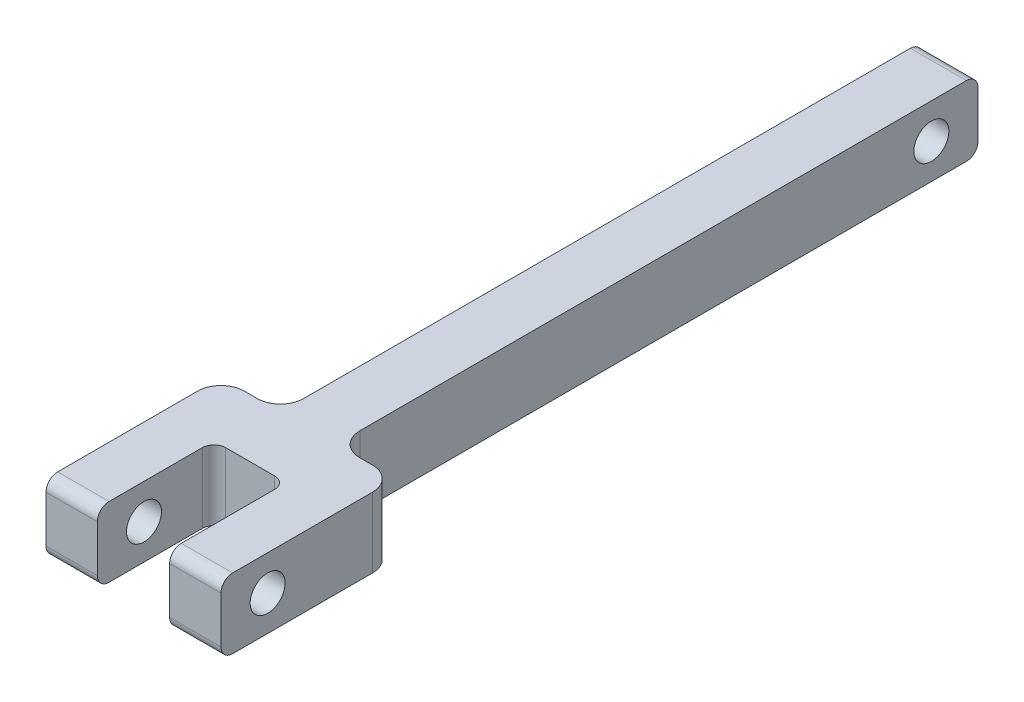
from build123d import *
from build123d.topology import SkipClean

# Parameters (mm, degrees)
SALIENTE_EXTRUIR1_DEPTH    = 2.4
CORTAR_EXTRUIR1_DEPTH      = 36.210225787
CORTAR_EXTRUIR1_DEPTH_BACK = 36.210225787
CROQUIS2_R                 = 1.5
CROQUIS3_R                 = 1.5
SALIENTE_EXTRUIR2_DEPTH    = 7.5
CORTAR_EXTRUIR2_DEPTH      = 3.1
REDONDEO1_R                = 2
REDONDEO2_R                = 1


with BuildPart() as part:
    # Croquis1 → Saliente-Extruir1 (new, symmetric)
    with BuildSketch(Plane(origin=(0, 0, 0), x_dir=(0, 0, -1), z_dir=(1, 0, 0))):
        with BuildLine():
            Line((-34, 3), (34, 3))
            ThreePointArc((34, 3), (34.707106781, 2.707106781), (35, 2))
            Line((35, 2), (35, -2))
            ThreePointArc((35, -2), (34.707106781, -2.707106781), (34, -3))
            Line((34, -3), (-34, -3))
            ThreePointArc((-34, -3), (-34.707106781, -2.707106781), (-35, -2))
            Line((-35, -2), (-35, 2))
            ThreePointArc((-35, 2), (-34.707106781, 2.707106781), (-34, 3))
        make_face()
    extrude(amount=SALIENTE_EXTRUIR1_DEPTH, both=True)

    # Croquis2 → Cortar-Extruir1 (cut, two sides: drawn at the far end of the back side and taken through both)
    with BuildSketch(Plane(origin=(0, 0, 0), x_dir=(0, 0, -1), z_dir=(1, 0, 0)).offset(-CORTAR_EXTRUIR1_DEPTH_BACK)):
        with Locations((-31, 0)):
            Circle(CROQUIS2_R)
        with Locations((31, 0)):
            Circle(CROQUIS2_R)
    extrude(amount=CORTAR_EXTRUIR1_DEPTH + CORTAR_EXTRUIR1_DEPTH_BACK, mode=Mode.SUBTRACT)

    # Croquis3 → Saliente-Extruir2 (add, symmetric)
    with SkipClean():  # the faces are left unmerged after this step: merging them gives an invalid solid
        with BuildSketch(Plane(origin=(0, 0, 0), x_dir=(0, 0, -1), z_dir=(1, 0, 0))):
            with BuildLine():
                Line((-35, 2), (-35, -2))
                ThreePointArc((-35, -2), (-34.707106781, -2.707106781), (-34, -3))
                Line((-34, -3), (-20, -3))
                Line((-20, -3), (-20, 3))
                Line((-20, 3), (-34, 3))
                ThreePointArc((-34, 3), (-34.707106781, 2.707106781), (-35, 2))
            make_face()
            with Locations((-31, 0)):
                Circle(CROQUIS3_R, mode=Mode.SUBTRACT)
        extrude(amount=SALIENTE_EXTRUIR2_DEPTH, both=True)
    add(part.part.scale(1), mode=Mode.REPLACE)  # the faces are merged on a copy

    # Croquis4 → Cortar-Extruir2 (cut, symmetric)
    with BuildSketch(Plane(origin=(0, 0, 0), x_dir=(0, 0, -1), z_dir=(1, 0, 0))):
        with BuildLine():
            Line((-34, 3), (-25, 3))
            Line((-25, 3), (-25, -3))
            Line((-25, -3), (-34, -3))
            ThreePointArc((-34, -3), (-34.707106781, -2.707106781), (-35, -2))
            Line((-35, -2), (-35, 2))
            ThreePointArc((-35, 2), (-34.707106781, 2.707106781), (-34, 3))
        make_face()
    extrude(amount=CORTAR_EXTRUIR2_DEPTH, both=True, mode=Mode.SUBTRACT)

    # Redondeo1
    redondeo1_edges = [part.edges().sort_by_distance(p)[0] for p in [
        (2.4, 0, 20),
        (-2.4, 0, 20),
        (7.5, 0, 20),
        (-7.5, 0, 20),
    ]]
    fillet(redondeo1_edges, radius=REDONDEO1_R)

    # Redondeo2
    redondeo2_edges = [part.edges().sort_by_distance(p)[0] for p in [
        (3.1, 0, 25),
        (-3.1, 0, 25),
    ]]
    fillet(redondeo2_edges, radius=REDONDEO2_R)


solid = part.part
